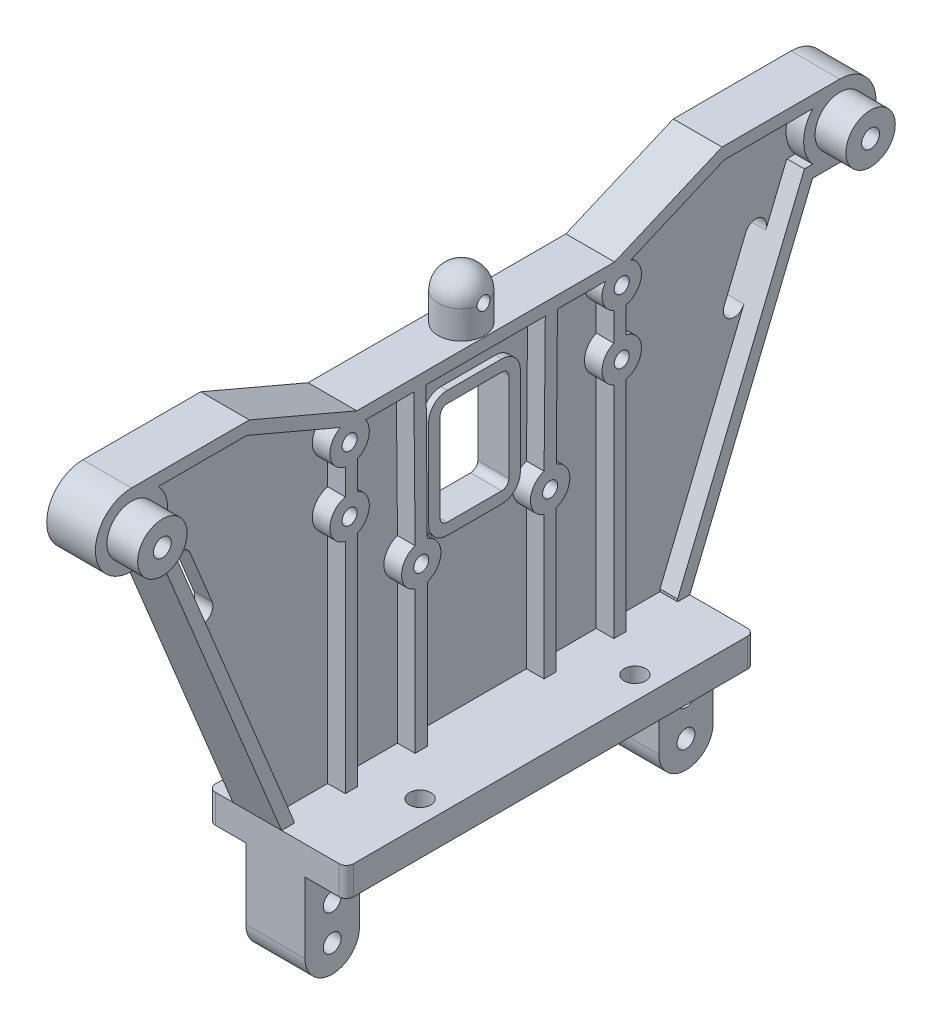
from build123d import *
from build123d.topology import SkipClean

# Parameters (mm, degrees)
SKETCH2_R               = 1.25
SKETCH2_R_2             = 1.05
BOSS_EXTRUDE1_DEPTH     = 1.27
SKETCH4_R               = 1.25
BOSS_EXTRUDE2_DEPTH     = 7
SKETCH5_R               = 1.5
BOSS_EXTRUDE3_DEPTH     = 4
SKETCH8_R               = 5.05
SKETCH8_R_2             = 1.25
BOSS_EXTRUDE4_DEPTH     = 1.8
EXTRUDE_THIN1_START     = -1.8
EXTRUDE_THIN1_DEPTH     = 1.8
RIB9_START              = -1.8
RIB9_OUTLINE_R          = 1.05
RIB9_OUTLINE_R_2        = 2.75
RIB9_DEPTH              = 1.8
EXTRUDE_THIN2_DEPTH     = 0.9
BOSS_EXTRUDE5_START     = 2.46
SKETCH12_R              = 5.05
SKETCH12_R_2            = 1.25
BOSS_EXTRUDE5_DEPTH     = 2.46
EXTRUDE_THIN3_DEPTH     = 2.46
RIB10_START             = -2.46
RIB10_OUTLINE_R         = 1.05
RIB10_DEPTH             = 2.46
BOSS_EXTRUDE6_START     = 4.3
SKETCH15_R              = 3.45
SKETCH15_R_2            = 1.25
BOSS_EXTRUDE6_DEPTH     = 4.3
CUT_EXTRUDE1_DEPTH      = 90.285589543
CUT_EXTRUDE1_DEPTH_BACK = 90.285589543
SKETCH17_R              = 0.9


# Read off the part's stored shape, not the designer's step: Rib9, Rib10
with BuildPart() as part:
    # Sketch2 → Boss-Extrude1 (new, symmetric)
    with BuildSketch(Plane(origin=(0, 0, 0), x_dir=(0, 0, -1), z_dir=(1, 0, 0))):
        with BuildLine():
            Line((-33, 0), (-49.45, 0))
            ThreePointArc((-49.45, 0), (-54.5, -5.05), (-49.45, -10.1))
            Line((-49.45, -10.1), (-45.65, -10.1))
            Line((-45.65, -10.1), (-28.5, -51.9))
            Line((-28.5, -51.9), (-28.5, -65.76))
            ThreePointArc((-28.5, -65.76), (-24.7, -69.56), (-20.9, -65.76))
            Line((-20.9, -65.76), (-20.9, -55.9))
            Line((-20.9, -55.9), (0, -55.9))
            Line((0, -55.9), (0, -27.75))
            Line((0, -27.75), (-3.8, -27.75))
            ThreePointArc((-3.8, -27.75), (-4.507106781, -27.457106781), (-4.8, -26.75))
            Line((-4.8, -26.75), (-4.8, -14.4))
            ThreePointArc((-4.8, -14.4), (-4.507106781, -13.692893219), (-3.8, -13.4))
            Line((-3.8, -13.4), (0, -13.4))
            Line((0, -13.4), (0, -6.4))
            Line((0, -6.4), (-18, -6.4))
            Line((-18, -6.4), (-33, 0))
        make_face()
        with Locations((-24.7, -65.76)):
            Circle(SKETCH2_R, mode=Mode.SUBTRACT)
        with Locations((-24.7, -60.76)):
            Circle(SKETCH2_R, mode=Mode.SUBTRACT)
        with BuildLine():
            ThreePointArc((-41.568465079, -15.569370966), (-40.750098064, -13.612262019), (-38.792989118, -14.430629034))
            Line((-38.792989118, -14.430629034), (-35.756343967, -21.831898265))
            ThreePointArc((-35.756343967, -21.831898265), (-36.574710982, -23.789007212), (-38.531819929, -22.970640197))
            Line((-38.531819929, -22.970640197), (-41.568465079, -15.569370966))
        make_face(mode=Mode.SUBTRACT)
        with Locations((-49.45, -5.05)):
            Circle(SKETCH2_R, mode=Mode.SUBTRACT)
        with Locations((-19, -18.7)):
            Circle(SKETCH2_R_2, mode=Mode.SUBTRACT)
        with Locations((-9, -29.4)):
            Circle(SKETCH2_R_2, mode=Mode.SUBTRACT)
        with Locations((-19, -9.7)):
            Circle(SKETCH2_R_2, mode=Mode.SUBTRACT)
    extrude(amount=BOSS_EXTRUDE1_DEPTH, both=True)

    # Sketch4 → Boss-Extrude2 (add)
    with BuildSketch(Plane(origin=(0, 0, 0), x_dir=(0, 0, -1), z_dir=(1, 0, 0))):
        with BuildLine():
            Line((-20.9, -51.9), (-20.9, -65.76))
            ThreePointArc((-20.9, -65.76), (-24.7, -69.56), (-28.5, -65.76))
            Line((-28.5, -65.76), (-28.5, -51.9))
            Line((-28.5, -51.9), (-20.9, -51.9))
        make_face()
        with Locations((-24.7, -65.76)):
            Circle(SKETCH4_R, mode=Mode.SUBTRACT)
        with Locations((-24.7, -60.76)):
            Circle(SKETCH4_R, mode=Mode.SUBTRACT)
    extrude(amount=BOSS_EXTRUDE2_DEPTH)

    # Sketch5 → Boss-Extrude3 (add)
    with BuildSketch(Plane.XZ.offset(55.9)):
        with BuildLine():
            Line((1.27, 0), (12.77, 0))
            Line((12.77, 0), (12.77, 27.5))
            ThreePointArc((12.77, 27.5), (12.477106781, 28.207106781), (11.77, 28.5))
            Line((11.77, 28.5), (-5.52, 28.5))
            ThreePointArc((-5.52, 28.5), (-6.227106781, 28.207106781), (-6.52, 27.5))
            Line((-6.52, 27.5), (-6.52, 0))
            Line((-6.52, 0), (-1.27, 0))
            Line((-1.27, 0), (-1.27, 20.9))
            Line((-1.27, 20.9), (1.27, 20.9))
            Line((1.27, 20.9), (1.27, 0))
        make_face()
        with Locations(Location((-3.32, 14, 0), (0, 0, 270))):
            Circle(SKETCH5_R, mode=Mode.SUBTRACT)
        with Locations(Location((9.57, 15, 0), (0, 0, 270))):
            Circle(SKETCH5_R, mode=Mode.SUBTRACT)
    extrude(amount=-BOSS_EXTRUDE3_DEPTH)

    # Sketch8 → Boss-Extrude4 (add)
    with SkipClean():  # the faces are left unmerged after this step: merging them gives an invalid solid
        with BuildSketch(Plane.ZY.offset(1.27)):
            with Locations((49.45, -5.05)):
                Circle(SKETCH8_R)
            with Locations((49.45, -5.05)):
                Circle(SKETCH8_R_2, mode=Mode.SUBTRACT)
        extrude(amount=BOSS_EXTRUDE4_DEPTH)

    # Sketch7 → Extrude-Thin1 (add)
    with BuildSketch(Plane.ZY.offset(3.07).offset(EXTRUDE_THIN1_START)):
        with BuildLine():
            Line((0, -6.4), (18, -6.4))
            Line((18, -6.4), (33, 0))
            Line((33, 0), (49.45, 0))
            ThreePointArc((49.45, 0), (54.5, -5.05), (49.45, -10.1))
            Line((49.45, -10.1), (45.65, -10.1))
            Line((45.65, -10.1), (28.5, -51.9))
            Line((28.5, -51.9), (28.5, -55.9))
            Line((28.5, -55.9), (26.8, -55.9))
            Line((26.8, -55.9), (26.8, -51.56481355))
            Line((26.8, -51.56481355), (44.509965368, -8.4))
            Line((44.509965368, -8.4), (49.45, -8.4))
            ThreePointArc((49.45, -8.4), (52.8, -5.05), (49.45, -1.7))
            Line((49.45, -1.7), (33.347511903, -1.7))
            Line((33.347511903, -1.7), (18.347511903, -8.1))
            Line((18.347511903, -8.1), (0, -8.1))
            Line((0, -8.1), (0, -6.4))
        make_face()
    extrude(amount=EXTRUDE_THIN1_DEPTH)

    # Rib9 outline → Rib9 (add)
    # profile 1 of 2: a face of its own
    with BuildSketch(Plane.ZY.offset(3.07).offset(RIB9_START)):
        with BuildLine():
            ThreePointArc((17.9, -16.179583368), (16.25, -18.7), (17.9, -21.220416632))
            Line((17.9, -21.220416632), (17.9, -51.9))
            Line((17.9, -51.9), (19.6, -51.9))
            Line((19.6, -51.9), (19.6, -21.38374738))
            ThreePointArc((19.6, -21.38374738), (20.771236686, -20.803620832), (21.542357226, -19.748293727))
            Line((21.542357226, -19.748293727), (44.487949505, -5.988378858))
            ThreePointArc((44.487949505, -5.988378858), (44.400370925, -4.988793771), (44.512152028, -3.991625109))
            Line((44.512152028, -3.991625109), (21.578599566, -17.744319992))
            ThreePointArc((21.578599566, -17.744319992), (20.808985354, -16.628751104), (19.6, -16.01625262))
            Line((19.6, -16.01625262), (19.6, -12.38374738))
            ThreePointArc((19.6, -12.38374738), (21.725300916, -10.067743008), (20.289861412, -7.27126421))
            Line((20.289861412, -7.27126421), (18.347511903, -8.1))
            Line((18.347511903, -8.1), (16.763373075, -8.1))
            ThreePointArc((16.763373075, -8.1), (16.349013747, -10.431280989), (17.9, -12.220416632))
            Line((17.9, -12.220416632), (17.9, -16.179583368))
        make_face()
        with Locations((19, -18.7)):
            Circle(RIB9_OUTLINE_R, mode=Mode.SUBTRACT)
        with Locations((19, -9.7)):
            Circle(RIB9_OUTLINE_R, mode=Mode.SUBTRACT)
    # profile 2 of 2: a face of its own
    with BuildSketch(Plane.ZY.offset(3.07).offset(RIB9_START)):
        with Locations((9, -29.4)):
            Circle(RIB9_OUTLINE_R_2)
        with Locations((9, -29.4)):
            Circle(RIB9_OUTLINE_R, mode=Mode.SUBTRACT)
    extrude(amount=RIB9_DEPTH)

    # Sketch11 → Extrude-Thin2 (add)
    with BuildSketch(Plane.ZY.offset(1.27)):
        with BuildLine():
            Line((0, -13.4), (3.8, -13.4))
            ThreePointArc((3.8, -13.4), (4.507106781, -13.692893219), (4.8, -14.4))
            Line((4.8, -14.4), (4.8, -26.75))
            ThreePointArc((4.8, -26.75), (4.507106781, -27.457106781), (3.8, -27.75))
            Line((3.8, -27.75), (0, -27.75))
            Line((0, -27.75), (0, -29.35))
            Line((0, -29.35), (3.8, -29.35))
            ThreePointArc((3.8, -29.35), (5.638477631, -28.588477631), (6.4, -26.75))
            Line((6.4, -26.75), (6.4, -14.4))
            ThreePointArc((6.4, -14.4), (5.638477631, -12.561522369), (3.8, -11.8))
            Line((3.8, -11.8), (0, -11.8))
            Line((0, -11.8), (0, -13.4))
        make_face()
    extrude_thin2 = extrude(amount=EXTRUDE_THIN2_DEPTH)

    # Sketch12 → Boss-Extrude5 (add)
    with BuildSketch(Plane(origin=(1.27, 0, 0), x_dir=(0, 0, -1), z_dir=(1, 0, 0)).offset(BOSS_EXTRUDE5_START)):
        with Locations(Location((-49.45, -5.05, 0), (0, 0, 180))):
            Circle(SKETCH12_R)
        with Locations(Location((-49.45, -5.05, 0), (0, 0, 180))):
            Circle(SKETCH12_R_2, mode=Mode.SUBTRACT)
    extrude(amount=-BOSS_EXTRUDE5_DEPTH)

    # Sketch13 → Extrude-Thin3 (add)
    with BuildSketch(Plane(origin=(3.73, 0, 0), x_dir=(0, 0, -1), z_dir=(1, 0, 0))):
        with BuildLine():
            Line((0, -6.4), (-18, -6.4))
            Line((-18, -6.4), (-33, 0))
            Line((-33, 0), (-49.45, 0))
            ThreePointArc((-49.45, 0), (-54.5, -5.05), (-49.45, -10.1))
            Line((-49.45, -10.1), (-45.65, -10.1))
            Line((-45.65, -10.1), (-28.5, -51.9))
            Line((-28.5, -51.9), (-28.5, -55.9))
            Line((-28.5, -55.9), (-26.8, -55.9))
            Line((-26.8, -55.9), (-26.8, -51.56481355))
            Line((-26.8, -51.56481355), (-44.509965368, -8.4))
            Line((-44.509965368, -8.4), (-49.45, -8.4))
            ThreePointArc((-49.45, -8.4), (-52.8, -5.05), (-49.45, -1.7))
            Line((-49.45, -1.7), (-33.347511903, -1.7))
            Line((-33.347511903, -1.7), (-18.347511903, -8.1))
            Line((-18.347511903, -8.1), (0, -8.1))
            Line((0, -8.1), (0, -6.4))
        make_face()
    extrude(amount=-EXTRUDE_THIN3_DEPTH)

    # Rib10 outline → Rib10 (add)
    # profile 1 of 2: a face of its own
    with BuildSketch(Plane(origin=(3.73, 0, 0), x_dir=(0, 0, -1), z_dir=(1, 0, 0)).offset(RIB10_START)):
        with BuildLine():
            ThreePointArc((-9.856422251, -26.786756627), (-11.749997926, -29.403377813), (-9.85, -32.015339366))
            Line((-9.85, -32.015339366), (-9.85, -51.9))
            Line((-9.85, -51.9), (-8.15, -51.9))
            Line((-8.15, -51.9), (-8.15, -32.015339366))
            ThreePointArc((-8.15, -32.015339366), (-6.250002051, -29.396641105), (-8.156391367, -26.782592031))
            Line((-8.156391367, -26.782592031), (-8.323721859, -8.1))
            Line((-8.323721859, -8.1), (-10.023790044, -8.1))
            Line((-10.023790044, -8.1), (-9.856422251, -26.786756627))
        make_face()
        with Locations((-9, -29.4)):
            Circle(RIB10_OUTLINE_R, mode=Mode.SUBTRACT)
    # profile 2 of 2: a face of its own
    with BuildSketch(Plane(origin=(3.73, 0, 0), x_dir=(0, 0, -1), z_dir=(1, 0, 0)).offset(RIB10_START)):
        with BuildLine():
            Line((-19.6, -51.9), (-17.9, -51.9))
            Line((-17.9, -51.9), (-17.9, -21.220416632))
            ThreePointArc((-17.9, -21.220416632), (-16.25, -18.7), (-17.9, -16.179583368))
            Line((-17.9, -16.179583368), (-17.9, -12.220416632))
            ThreePointArc((-17.9, -12.220416632), (-16.349013747, -10.431280989), (-16.763373075, -8.1))
            Line((-16.763373075, -8.1), (-18.347511903, -8.1))
            Line((-18.347511903, -8.1), (-20.289861412, -7.27126421))
            ThreePointArc((-20.289861412, -7.27126421), (-21.725300916, -10.067743008), (-19.6, -12.38374738))
            Line((-19.6, -12.38374738), (-19.6, -16.01625262))
            ThreePointArc((-19.6, -16.01625262), (-21.75, -18.7), (-19.6, -21.38374738))
            Line((-19.6, -21.38374738), (-19.6, -51.9))
        make_face()
        with Locations((-19, -18.7)):
            Circle(RIB10_OUTLINE_R, mode=Mode.SUBTRACT)
        with Locations((-19, -9.7)):
            Circle(RIB10_OUTLINE_R, mode=Mode.SUBTRACT)
    extrude(amount=RIB10_DEPTH)

    # Mirror2: Extrude-Thin2 across plane
    add(extrude_thin2.mirror(Plane(origin=(0, 0, 0), x_dir=(0, 0, 1), z_dir=(1, 0, 0))))

    # Sketch15 → Boss-Extrude6 (add)
    with BuildSketch(Plane(origin=(3.73, 0, 0), x_dir=(0, 0, -1), z_dir=(1, 0, 0)).offset(BOSS_EXTRUDE6_START)):
        with Locations(Location((-49.45, -5.05, 0), (0, 0, 180))):
            Circle(SKETCH15_R)
        with Locations(Location((-49.45, -5.05, 0), (0, 0, 180))):
            Circle(SKETCH15_R_2, mode=Mode.SUBTRACT)
    extrude(amount=-BOSS_EXTRUDE6_DEPTH)

    # Mirror3: part across plane


with BuildPart() as part_1:
    add(part.part)
    add(part.part.mirror(Plane(origin=(1.27, 0, 0), x_dir=(1, 0, 0), z_dir=(0, 0, -1))))

    # Sketch16 → Revolve1 (revolve)
    with SkipClean():  # the faces are left unmerged after this step: merging them gives an invalid solid
        with BuildSketch(Plane.XY, mode=Mode.PRIVATE) as revolve1_sk:
            with BuildLine():
                ThreePointArc((0.33, 0.74), (-1.950419369, -0.204580631), (-2.895, -2.485))
                ThreePointArc((-2.895, -2.485), (-1.950419369, -4.765419369), (0.33, -5.71))
                Line((0.33, -5.71), (0.33, 0.74))
            make_face()
            with BuildLine():
                ThreePointArc((3.555, -2.485), (2.610419369, -0.204580631), (0.33, 0.74))
                Line((0.33, 0.74), (0.33, -5.71))
                ThreePointArc((0.33, -5.71), (2.610419369, -4.765419369), (3.555, -2.485))
            make_face()
            with BuildLine():
                Line((0.33, -5.71), (0.33, -6.4))
                Line((0.33, -6.4), (3.555, -6.4))
                Line((3.555, -6.4), (3.555, -2.485))
                ThreePointArc((3.555, -2.485), (2.610419369, -4.765419369), (0.33, -5.71))
            make_face()
        revolve(revolve1_sk.sketch.rotate(Axis((0.33, 0.74, 0), (0, -1, 0)), 180), axis=Axis((0.33, 0.74, 0), (0, -1, 0)))

    # Sketch17 → Cut-Extrude1 (cut, two sides: drawn at the far end of the back side and taken through both)
    with BuildSketch(Plane(origin=(0, 0, 0), x_dir=(0, 0, -1), z_dir=(1, 0, 0)).offset(-CUT_EXTRUDE1_DEPTH_BACK)):
        with Locations((0, -2.485)):
            Circle(SKETCH17_R)
    extrude(amount=CUT_EXTRUDE1_DEPTH + CUT_EXTRUDE1_DEPTH_BACK, mode=Mode.SUBTRACT)


solid = part_1.part
